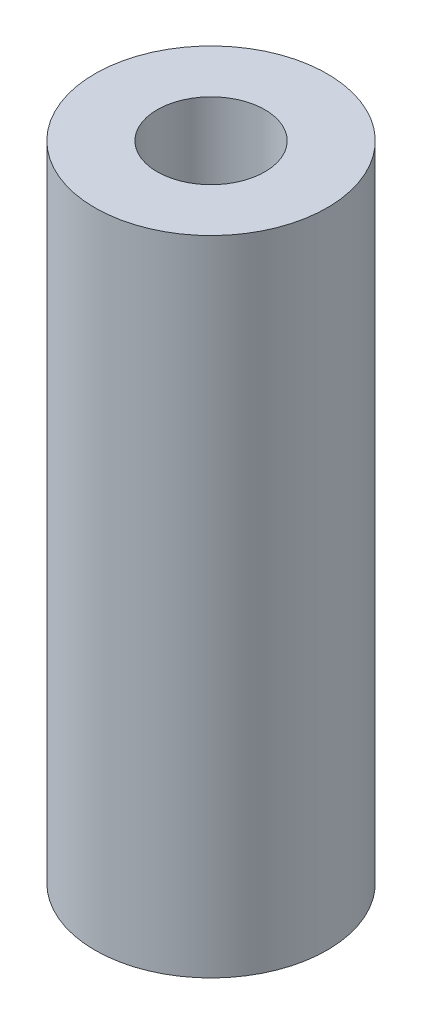
from build123d import *

# Parameters (mm, degrees)
SKETCH1_R           = 3.45
SKETCH1_R_2         = 1.6
BOSS_EXTRUDE2_DEPTH = 19.1


with BuildPart() as part:
    # Sketch1 → Boss-Extrude2 (new body)
    with BuildSketch(Plane(origin=(0, 0, 0), x_dir=(1, 0, 0), z_dir=(0, 1, 0))):
        Circle(SKETCH1_R)
        Circle(SKETCH1_R_2, mode=Mode.SUBTRACT)
    extrude(amount=BOSS_EXTRUDE2_DEPTH)


solid = part.part
